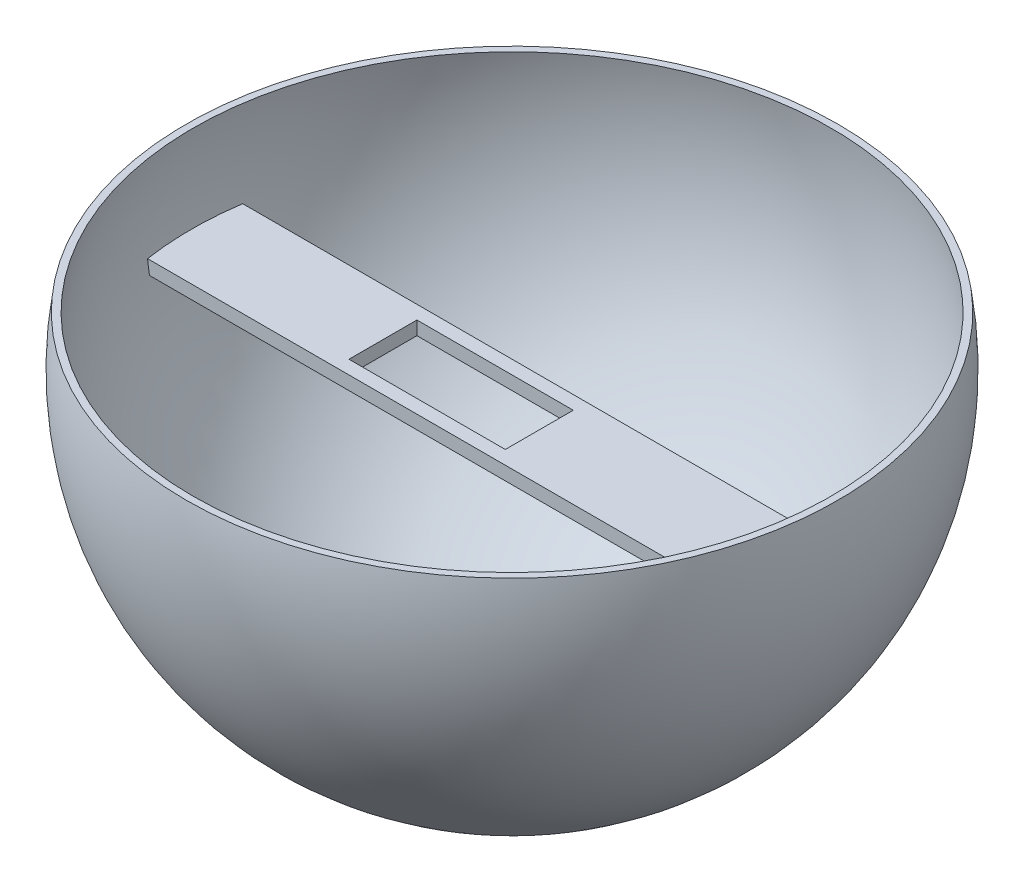
from build123d import *

# Parameters (mm, degrees)
SHELL_1_T           = -1
EXTRUDE_1_REACH     = 86.004
SKETCH_3_W          = 14
SKETCH_3_H          = 2
EXTRUDE_2_REACH     = 86.004
SKETCH_4_W          = 14
SKETCH_4_H          = 2
SKETCH_5_W          = 23
SKETCH_5_H          = 10
CUT_EXTRUDE_2_DEPTH = 5


with BuildPart() as part:
    # 草图1 → 旋转1 (revolve)
    with BuildSketch(Plane(origin=(0, 0, 0), x_dir=(0, 0, -1), z_dir=(1, 0, 0))):
        with BuildLine():
            Line((-47.942112449, 7.335111039), (0, 7.335111039))
            Line((0, 7.335111039), (0, -48.5))
            ThreePointArc((0, -48.5), (-36.79675859, -31.595071725), (-47.942112449, 7.335111039))
        make_face()
    revolve(axis=Axis((0, 7.335111039, 0), (0, -1, 0)))

    # 抽壳1
    shell_1_openings = [part.faces().sort_by_distance(p)[0] for p in [
        (0, 7.335111039, 0),
    ]]
    offset(amount=SHELL_1_T, openings=shell_1_openings, kind=Kind.INTERSECTION)

    # 草图3 → 凸台-拉伸1 (add, up to next)
    with BuildSketch(Plane(origin=(0, 0, 0), x_dir=(0, 0, -1), z_dir=(1, 0, 0)), mode=Mode.PRIVATE) as extrude_1_sk1:
        with Locations((0, -6.664888961)):
            Rectangle(SKETCH_3_W, SKETCH_3_H)
    extrude_1_tool1 = extrude(extrude_1_sk1.sketch, amount=EXTRUDE_1_REACH, mode=Mode.PRIVATE) - part.part
    add(extrude_1_tool1.solids().sort_by_distance((0, -6.664889, 0))[0])

    # 草图4 → 凸台-拉伸2 (add, up to next)
    with BuildSketch(Plane(origin=(0, 0, 0), x_dir=(0, 0, -1), z_dir=(1, 0, 0)), mode=Mode.PRIVATE) as extrude_2_sk1:
        with Locations((0, -6.664888961)):
            Rectangle(SKETCH_4_W, SKETCH_4_H)
    extrude_2_tool1 = extrude(extrude_2_sk1.sketch, amount=-EXTRUDE_2_REACH, mode=Mode.PRIVATE) - part.part
    add(extrude_2_tool1.solids().sort_by_distance((0, -6.664889, 0))[0])

    # 草图5 → 切除-拉伸2 (cut)
    with BuildSketch(Plane(origin=(0, -7.664888961, 0), x_dir=(1, 0, 0), z_dir=(0, 1, 0))):
        with Locations((-7.5, 0)):
            Rectangle(SKETCH_5_W, SKETCH_5_H)
    extrude(amount=CUT_EXTRUDE_2_DEPTH, mode=Mode.SUBTRACT)


solid = part.part
